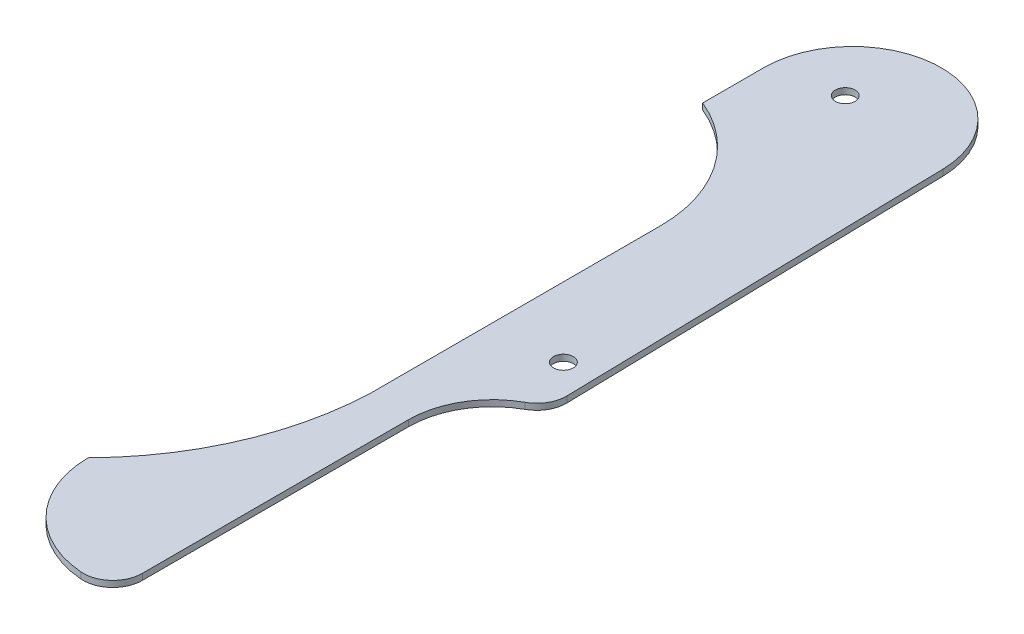
from build123d import *

# Parameters (mm, degrees)
SKETCH1_R           = 1
BOSS_EXTRUDE1_DEPTH = 0.625


with BuildPart() as part:
    # Sketch1 → Boss-Extrude1 (new body)
    with BuildSketch(Plane(origin=(0, 0, 0), x_dir=(1, 0, 0), z_dir=(0, 1, 0))):
        with BuildLine():
            Line((8.997858244, 2.423307145), (9.848841271, -36.576692855))
            ThreePointArc((9.848841271, -36.576692855), (9.449049837, -38.139678019), (8.297497314, -39.26958182))
            ThreePointArc((8.297497314, -39.26958182), (5.081486735, -42.390887707), (3.9, -46.714007366))
            Line((3.9, -46.714007366), (3.9, -73.714007366))
            ThreePointArc((3.9, -73.714007366), (2.934734568, -75.918515302), (0.660096509, -76.704399701))
            ThreePointArc((0.660096509, -76.704399701), (-6.19183571, -73.385709721), (-9, -66.309206939))
            ThreePointArc((-9, -66.309206939), (-2.386951858, -56.128417461), (-0.35, -44.160472472))
            Line((-0.35, -44.160472472), (-0.35, -16.910472472))
            ThreePointArc((-0.35, -16.910472472), (-2.711701155, -9.129084421), (-9, -3.97302682))
            Line((-9, -3.97302682), (-9, 2.22697318))
            ThreePointArc((-9, 2.22697318), (-0.098172823, 11.226437725), (8.997858244, 2.423307145))
        make_face()
        with Locations((-2.41, 3.89697318)):
            Circle(SKETCH1_R, mode=Mode.SUBTRACT)
        with Locations((6.712356958, -33.812416771)):
            Circle(SKETCH1_R, mode=Mode.SUBTRACT)
    extrude(amount=BOSS_EXTRUDE1_DEPTH)


solid = part.part
